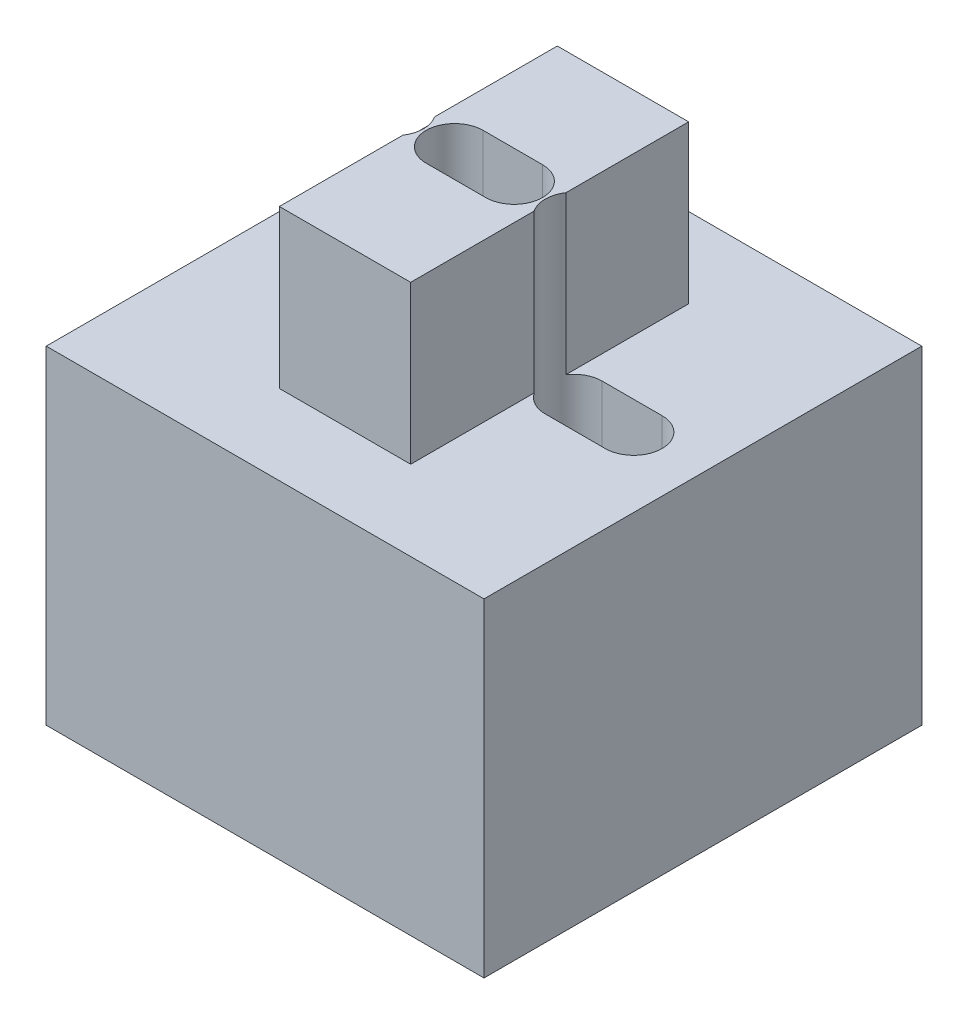
from build123d import *

# Parameters (mm, degrees)
SKETCH1_W               = 10
SKETCH1_H               = 10
BOSS_EXTRUDE1_DEPTH     = 7.5
SKETCH2_W               = 3
SKETCH2_H               = 6.349019662
BOSS_EXTRUDE2_DEPTH     = 3.6
CUT_EXTRUDE2_DEPTH      = 14.4370788
CUT_EXTRUDE2_DEPTH_BACK = 14.4370788
CUT_EXTRUDE3_DEPTH      = 11.65809958
CUT_EXTRUDE3_DEPTH_BACK = 11.65809958


with BuildPart() as part:
    # Sketch1 → Boss-Extrude1 (new body)
    with BuildSketch(Plane(origin=(0, 0, 0), x_dir=(1, 0, 0), z_dir=(0, 1, 0))):
        with Locations((-0.68, -0.008261841)):
            Rectangle(SKETCH1_W, SKETCH1_H)
    extrude(amount=BOSS_EXTRUDE1_DEPTH)

    # Sketch2 → Boss-Extrude2 (add)
    with BuildSketch(Plane(origin=(0, 7.5, 0), x_dir=(1, 0, 0), z_dir=(0, 1, 0))):
        with Locations((-0.68, -0.008261841)):
            Rectangle(SKETCH2_W, SKETCH2_H)
    extrude(amount=BOSS_EXTRUDE2_DEPTH)

    # Sketch4 → Cut-Extrude2 (cut, two sides: drawn at the far end of the back side and taken through both)
    with BuildSketch(Plane(origin=(0, 11.1, 0), x_dir=(1, 0, 0), z_dir=(0, 1, 0)).offset(-CUT_EXTRUDE2_DEPTH_BACK)):
        with BuildLine():
            Line((-1.36, 0.65), (0, 0.65))
            ThreePointArc((0, 0.65), (0.65, 0), (0, -0.65))
            Line((0, -0.65), (-1.36, -0.65))
            ThreePointArc((-1.36, -0.65), (-2.01, 0), (-1.36, 0.65))
        make_face()
    extrude(amount=CUT_EXTRUDE2_DEPTH + CUT_EXTRUDE2_DEPTH_BACK, mode=Mode.SUBTRACT)

    # Sketch5 → Cut-Extrude3 (cut, two sides: drawn at the far end of the back side and taken through both)
    with BuildSketch(Plane(origin=(0, 7.5, 0), x_dir=(1, 0, 0), z_dir=(0, 1, 0)).offset(-CUT_EXTRUDE3_DEPTH_BACK)):
        with BuildLine():
            Line((-4.146431657, 0.65), (-2.72, 0.65))
            ThreePointArc((-2.72, 0.65), (-2.07, 0), (-2.72, -0.65))
            Line((-2.72, -0.65), (-4.146431657, -0.65))
            ThreePointArc((-4.146431657, -0.65), (-4.796431657, 0), (-4.146431657, 0.65))
        make_face()
        with BuildLine():
            Line((2.730280574, 0.65), (1.36, 0.65))
            ThreePointArc((1.36, 0.65), (0.71, 0), (1.36, -0.65))
            Line((1.36, -0.65), (2.730280574, -0.65))
            ThreePointArc((2.730280574, -0.65), (3.380280574, 0), (2.730280574, 0.65))
        make_face()
    extrude(amount=CUT_EXTRUDE3_DEPTH + CUT_EXTRUDE3_DEPTH_BACK, mode=Mode.SUBTRACT)


solid = part.part
